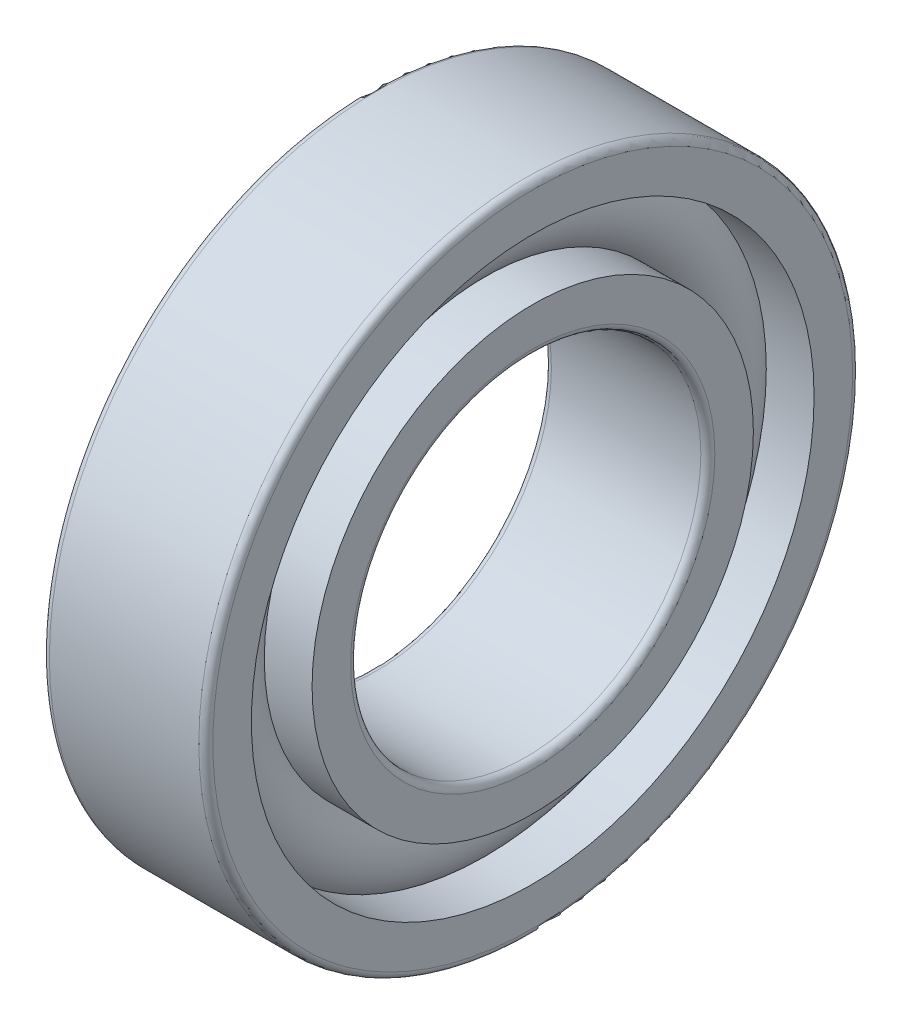
from build123d import *

# Parameters (mm, degrees)
CAGSPISKE_W     = 0.39
CAGSPISKE_H     = 0.65
CAGESPINE_ANGLE = 0.001
BALSIMSKE_R     = 1.95


with BuildPart() as part:
    # CagSpiSke → CageSpine (revolve)
    with BuildSketch(Plane.XY):
        with Locations((0, 10.75)):
            Rectangle(CAGSPISKE_W, CAGSPISKE_H)
    revolve(axis=Axis((-20.6375, 0, 0), (-1, 0, 0)), revolution_arc=CAGESPINE_ANGLE)

    # BalSimSke → BallsSimplified (revolve)
    with BuildSketch(Plane.XY):
        with Locations((0, 10.75)):
            Circle(BALSIMSKE_R)
    revolve(axis=Axis((-10, 0, 0), (1, 0, 0)))

    # InnRacSke → InnerRace (revolve)
    with BuildSketch(Plane.XY):
        with BuildLine():
            Line((-1.419727086, 9.45), (-3.5, 9.45))
            Line((-3.5, 9.45), (-3.5, 7.8))
            ThreePointArc((-3.5, 7.8), (-3.412132034, 7.587867966), (-3.2, 7.5))
            Line((-3.2, 7.5), (3.2, 7.5))
            ThreePointArc((3.2, 7.5), (3.412132034, 7.587867966), (3.5, 7.8))
            Line((3.5, 7.8), (3.5, 9.45))
            Line((3.5, 9.45), (1.419727086, 9.45))
            ThreePointArc((1.419727086, 9.45), (0, 8.825), (-1.419727086, 9.45))
        make_face()
    revolve(axis=Axis((-20.6375, 0, 0), (1, 0, 0)))

    # OutRacSke → OuterRace (revolve)
    with BuildSketch(Plane.XY):
        with BuildLine():
            Line((-1.419727086, 12.05), (-3.5, 12.05))
            Line((-3.5, 12.05), (-3.5, 13.7))
            ThreePointArc((-3.5, 13.7), (-3.412132034, 13.912132034), (-3.2, 14))
            Line((-3.2, 14), (3.2, 14))
            ThreePointArc((3.2, 14), (3.412132034, 13.912132034), (3.5, 13.7))
            Line((3.5, 13.7), (3.5, 12.05))
            Line((3.5, 12.05), (1.419727086, 12.05))
            ThreePointArc((1.419727086, 12.05), (0, 12.675), (-1.419727086, 12.05))
        make_face()
    revolve(axis=Axis((-20.6375, 0, 0), (1, 0, 0)))


solid = part.part
